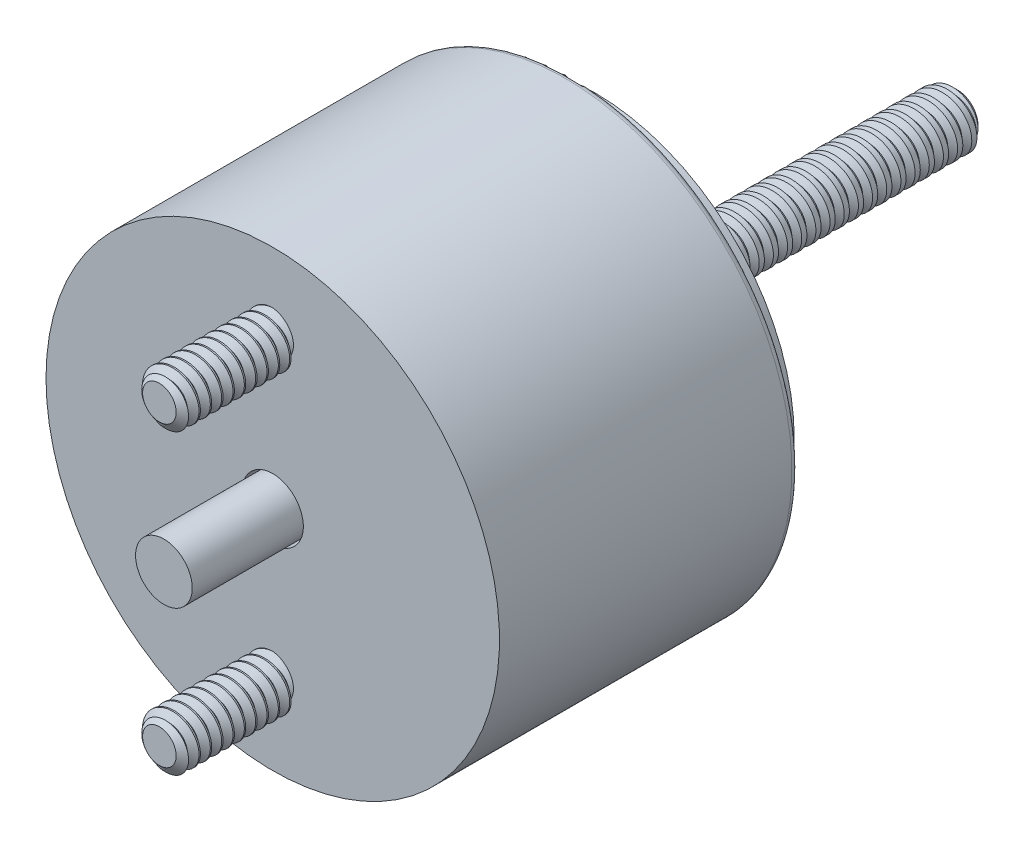
from build123d import *

# Parameters (mm, degrees)
CUT_SWEEP1_PITCH       = 0.7937499999999986
CUT_SWEEP1_HEIGHT      = 22.383749999999825
CUT_SWEEP1_RADIUS      = 1.7526
CUT_SWEEP1_START_ANGLE = 90.0000000000002
SKETCH5_OUTSIDE_W      = 45.18
SKETCH5_OUTSIDE_H      = 45.18
SKETCH5_OUTSIDE_R      = 1.1511182937778355
CUT_EXTRUDE1_DEPTH     = 3.175
CUT_EXTRUDE1_DRAFT     = -45.0000000000001
SKETCH6_R              = 1.4223999999999992
BOSS_EXTRUDE1_DEPTH    = 6.35
CUT_SWEEP2_PITCH       = 0.6349999999999959
CUT_SWEEP2_TO          = 6.35
SKETCH9_OUTSIDE_W      = 159.378
SKETCH9_OUTSIDE_H      = 159.378
SKETCH9_OUTSIDE_R      = 0.9412146350222687
CUT_EXTRUDE2_DEPTH     = 42.20440587384801
CUT_EXTRUDE2_DRAFT     = -55.00000000000012
LPATTERN1_COUNT        = 2
LPATTERN1_PITCH        = 16.6624


with BuildPart() as part:
    # Sketch1 → Revolve1 (revolve)
    with BuildSketch(Plane(origin=(0, 0, 0), x_dir=(0, 0, -1), z_dir=(1, 0, 0)), mode=Mode.PRIVATE) as revolve1_sk:
        with BuildLine():
            Line((16.383000000000006, 12.699999999999998), (8.7e-16, 12.699999999999998))
            Line((8.7e-16, 12.699999999999998), (1.35e-15, 1.7145000000000008))
            Line((1.35e-15, 1.7145000000000008), (18.034000000000002, 1.7145000000000001))
            Line((18.034000000000002, 1.7145000000000001), (18.034000000000002, 11.176))
            Line((18.034000000000002, 11.176), (17.018000000000004, 11.176))
            Line((17.018000000000004, 11.176), (17.018000000000004, 10.921999999999999))
            Line((17.018000000000004, 10.921999999999999), (16.764000000000003, 10.921999999999999))
            Line((16.764000000000003, 10.921999999999999), (16.764000000000006, 12.319))
            ThreePointArc((16.764000000000006, 12.319), (16.65240768363208, 12.588407683632076), (16.383000000000006, 12.699999999999998))
        make_face()
    revolve(revolve1_sk.sketch.rotate(Axis((0, 0, -16.764000000000003), (0, 0, 1)), 90), axis=Axis((0, 0, -16.764000000000003), (0, 0, 1)))


with BuildPart() as body_2:
    # Sketch2 → Revolve2 (revolve)
    with BuildSketch(Plane(origin=(0, 0, 0), x_dir=(0, 0, -1), z_dir=(1, 0, 0)), mode=Mode.PRIVATE) as revolve2_sk:
        Polygon((30.734000000000005, 2.5e-16), (-13.716000000000001, 2.5e-16), (-13.716000000000001, 1.5875000000000001), (30.734000000000005, 1.5875000000000021), align=None)
    revolve(revolve2_sk.sketch.rotate(Axis((0, 2.5e-16, -30.734000000000005), (0, 0, 1)), 90), axis=Axis((0, 2.5e-16, -30.734000000000005), (0, 0, 1)))

    # Cut-Sweep1: sweep along a helix
    with BuildLine() as cut_sweep1_path:
        add(Helix(CUT_SWEEP1_PITCH, CUT_SWEEP1_HEIGHT, CUT_SWEEP1_RADIUS, center=(0, -9.6e-16, -30.734000000000005), direction=(0, 0, 1), mode=Mode.PRIVATE).rotate(Axis((0, -9.6e-16, -30.734000000000005), (0, 0, 1)), CUT_SWEEP1_START_ANGLE))
    # Sketch4 → Cut-Sweep1 (sweep, cut)
    with BuildSketch(Plane(origin=(0, 0, 0), x_dir=(0, 0, -1), z_dir=(1, 0, 0))):
        Polygon((31.031656250000008, 1.237044251809578), (31.13087500000001, 1.237044251809578), (31.453335937500007, 1.7955629790158714), (30.7091953125, 1.7955629790158734), align=None)
    sweep(path=cut_sweep1_path.line, is_frenet=True, mode=Mode.SUBTRACT)


with BuildPart() as cut_extrude1_tool:
    # Sketch5 outside → Cut-Extrude1 (with draft: the straight prism first)
    with BuildSketch(Plane(origin=(0, 0, -30.734000000000005), x_dir=(-1, 0, 0), z_dir=(0, 0, -1))):
        Rectangle(SKETCH5_OUTSIDE_W, SKETCH5_OUTSIDE_H)
        Circle(SKETCH5_OUTSIDE_R, mode=Mode.SUBTRACT)
    extrude(amount=-CUT_EXTRUDE1_DEPTH)
    # Cut-Extrude1: the draft: its side faces are tilted about the plane it starts from
    cut_extrude1_sides = [cut_extrude1_tool.faces().sort_by_distance(p)[0] for p in [
        (0, -22.59, -29.1465),
        (-22.59, 0, -29.1465),
        (0, 22.59, -29.1465),
        (22.59, 0, -29.1465),
        (1.151118294, 0, -29.1465),
    ]]
    draft(cut_extrude1_sides, Plane(origin=(0, 0, -30.734000000000005), x_dir=(-1, 0, 0), z_dir=(0, 0, -1)), CUT_EXTRUDE1_DRAFT)


with BuildPart() as body_2_1:
    add(body_2.part)

    # Cut-Extrude1: cut by cut_extrude1_tool
    add(cut_extrude1_tool.part, mode=Mode.SUBTRACT)


with BuildPart() as body_3:
    # Sketch6 → Boss-Extrude1 (new body)
    with BuildSketch(Plane.XY):
        with Locations((0, 8.3312)):
            Circle(SKETCH6_R)
    extrude(amount=BOSS_EXTRUDE1_DEPTH)

    # Cut-Sweep2: arcs per turn and ends read off the stored shape
    # Cut-Sweep2: the profile of Sketch8 screwed along a right-hand helix through 12 turns, 6 arcs to a turn; built about Z, then put on its axis
    cut_sweep2_z = Axis((0, 0, 0), (0, 0, 1))
    cut_sweep2_corners = [(1.456770383, 0, -1.21046875), (1.009955401, 0, -0.9525), (1.009955401, 0, -0.873125), (1.456770383, 0, -0.61515625)]
    with BuildLine(mode=Mode.PRIVATE) as cut_sweep2_profile:
        Line(cut_sweep2_corners[0], cut_sweep2_corners[1])
        Line(cut_sweep2_corners[1], cut_sweep2_corners[2])
        Line(cut_sweep2_corners[2], cut_sweep2_corners[3])
        Line(cut_sweep2_corners[3], cut_sweep2_corners[0])
    cut_sweep2_cap = Face(cut_sweep2_profile.wire())
    cut_sweep2_turn_angles = [0, 30, 60, 90, 120, 150, 180, 210, 240, 270, 300, 330, 360]
    cut_sweep2_turn_weights = [1, 0.8660254037844387, 1, 0.8660254037844387, 1, 0.8660254037844387, 1, 0.8660254037844387, 1, 0.8660254037844387, 1, 0.8660254037844387, 1]
    cut_sweep2_turn_rails = [Edge.make_bspline([Vector(p[0], p[1], 0).rotate(cut_sweep2_z, cut_sweep2_turn_angles[k]) / cut_sweep2_turn_weights[k] + Vector(0, 0, p[2] + CUT_SWEEP2_PITCH * cut_sweep2_turn_angles[k] / 360) for k in range(13)], [0, 0, 0, 1, 1, 2, 2, 3, 3, 4, 4, 5, 5, 6, 6, 6], 2, cut_sweep2_turn_weights) for p in cut_sweep2_corners]
    cut_sweep2_turn_sides = [Face.make_surface_from_curves(cut_sweep2_turn_rails[p[0]], cut_sweep2_turn_rails[p[1]]) for p in [(0, 1), (1, 2), (2, 3), (3, 0)]]
    cut_sweep2 = Plane(origin=(0, 8.3312, 6.349999999999999), x_dir=(-3.49e-15, 1, 0), z_dir=(0, 0, -1)) * split(Solid(Shell([*[p.moved(Location((0, 0, CUT_SWEEP2_PITCH * i))) for i in range(12) for p in cut_sweep2_turn_sides], cut_sweep2_cap, cut_sweep2_cap.rotate(cut_sweep2_z, 4320).moved(Location((0, 0, CUT_SWEEP2_PITCH * 4320 / 360)))])), bisect_by=Plane.XY.offset(CUT_SWEEP2_TO), keep=Keep.BOTTOM, mode=Mode.PRIVATE)
    add(cut_sweep2, mode=Mode.SUBTRACT)


with BuildPart() as cut_extrude2_tool:
    # Sketch9 outside → Cut-Extrude2 (with draft: the straight prism first)
    with BuildSketch(Plane.XY.offset(6.349999999999999)):
        Rectangle(SKETCH9_OUTSIDE_W, SKETCH9_OUTSIDE_H)
        with Locations((0, 8.3312)):
            Circle(SKETCH9_OUTSIDE_R, mode=Mode.SUBTRACT)
    extrude(amount=-CUT_EXTRUDE2_DEPTH)
    # Cut-Extrude2: the draft: its side faces are tilted about the plane it starts from
    cut_extrude2_sides = [cut_extrude2_tool.faces().sort_by_distance(p)[0] for p in [
        (0, -79.689, -14.752202937),
        (79.689, 0, -14.752202937),
        (0, 79.689, -14.752202937),
        (-79.689, 0, -14.752202937),
        (-0.941214635, 8.3312, -14.752202937),
    ]]
    draft(cut_extrude2_sides, Plane.XY.offset(6.349999999999999), CUT_EXTRUDE2_DRAFT)


with BuildPart() as body_3_1:
    add(body_3.part)

    # Cut-Extrude2: cut by cut_extrude2_tool
    add(cut_extrude2_tool.part, mode=Mode.SUBTRACT)


with BuildPart() as lpattern1_1:
    # LPattern1: pattern copy
    add(body_3_1.part.moved(Location(Vector(0, -1, 0) * (1 * LPATTERN1_PITCH))))


with BuildPart() as part_1:
    add(part.part)

    # Combine1: union body 3, LPattern1_1
    add(body_3_1.part)
    add(lpattern1_1.part)


with BuildPart() as body_2_2:
    # Body-Move/Copy1: moved
    add(body_2_1.part.moved(Location((0, 6.8e-16, -7.62))))


solid = Compound([part_1.part, body_2_2.part])
